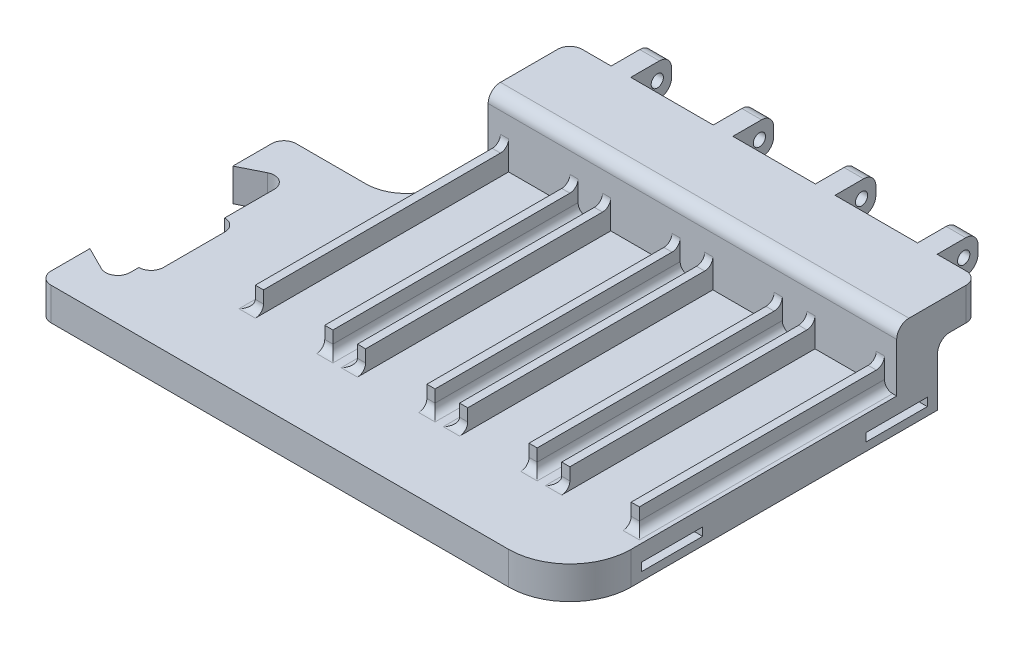
from build123d import *

# Parameters (mm, degrees)
CROQUIS1_R                 = 1.5
SALIENTE_EXTRUIR1_DEPTH    = 50
CORTAR_EXTRUIR1_DEPTH      = 123.737524824
CORTAR_EXTRUIR1_DEPTH_BACK = 123.737524824
CROQUIS2_W                 = 10.1
CROQUIS2_H                 = 10
CROQUIS2_W_2               = 20.2
REDONDEO3_R                = 3
CROQUIS6_W                 = 80
CROQUIS6_H                 = 15
CORTAR_EXTRUIR5_DEPTH      = 151.214846137
CROQUIS29_W                = 2
CROQUIS29_H                = 60
SALIENTE_EXTRUIR16_DEPTH   = 5
REDONDEO17_R               = 2
CROQUIS19_W                = 60
CROQUIS19_H                = 8
SALIENTE_EXTRUIR10_DEPTH   = 30
REDONDEO12_R               = 15
REDONDEO15_R               = 3
REDONDEO23_R               = 10
CORTAR_EXTRUIR6_DEPTH      = 139.047998899
CORTAR_EXTRUIR4_DEPTH      = 138.71165528
CORTAR_EXTRUIR4_DEPTH_BACK = 138.71165528
CROQUIS4_W                 = 15
CROQUIS4_H                 = 2
REDONDEO24_R               = 3
CROQUIS31_W                = 3
CROQUIS31_H                = 21
CORTAR_EXTRUIR7_DEPTH      = 139.047998899
REDONDEO27_R               = 3


with BuildPart() as part:
    # Croquis1 → Saliente-Extruir1 (new, symmetric)
    with BuildSketch(Plane(origin=(0, 0, 0), x_dir=(0, 0, -1), z_dir=(1, 0, 0))):
        Polygon((-1.5, 11.5), (-1.5, 3.5), (-21.5, 3.5), (-21.5, -11.5), (-111.5, -11.5), (-111.5, 11.5), align=None)
        with Locations((-5, 7.5)):
            Circle(CROQUIS1_R, mode=Mode.SUBTRACT)
    extrude(amount=SALIENTE_EXTRUIR1_DEPTH, both=True)

    # Croquis2 → Cortar-Extruir1 (cut, two sides: drawn at the far end of the back side and taken through both)
    with BuildSketch(Plane(origin=(0, 0, 0), x_dir=(1, 0, 0), z_dir=(0, 1, 0)).offset(-CORTAR_EXTRUIR1_DEPTH_BACK)):
        with Locations((-44.95, -6.5)):
            Rectangle(CROQUIS2_W, CROQUIS2_H)
        with Locations((-25, -6.5)):
            Rectangle(CROQUIS2_W_2, CROQUIS2_H)
        with Locations((0, -6.5)):
            Rectangle(CROQUIS2_W_2, CROQUIS2_H)
        with Locations((25, -6.5)):
            Rectangle(CROQUIS2_W_2, CROQUIS2_H)
        with Locations((44.95, -6.5)):
            Rectangle(CROQUIS2_W, CROQUIS2_H)
    extrude(amount=CORTAR_EXTRUIR1_DEPTH + CORTAR_EXTRUIR1_DEPTH_BACK, mode=Mode.SUBTRACT)

    # Redondeo3
    redondeo3_edges = [part.edges().sort_by_distance(p)[0] for p in [
        (0, 3.5, 21.5),
        (37.5, 11.5, 1.5),
        (12.5, 11.5, 1.5),
        (-12.5, 11.5, 1.5),
        (-37.5, 11.5, 1.5),
        (37.5, 3.5, 1.5),
        (12.5, 3.5, 1.5),
        (-12.5, 3.5, 1.5),
        (-37.5, 3.5, 1.5),
        (-50, 7.5, 11.5),
        (50, 7.5, 11.5),
    ]]
    fillet(redondeo3_edges, radius=REDONDEO3_R)

    # Croquis6 → Cortar-Extruir5 (cut, through all)
    with BuildSketch(Plane.ZY.offset(50)):
        with Locations((71.5, 4)):
            Rectangle(CROQUIS6_W, CROQUIS6_H)
    extrude(amount=-CORTAR_EXTRUIR5_DEPTH, mode=Mode.SUBTRACT)

    # Croquis29 → Saliente-Extruir16 (add)
    with BuildSketch(Plane(origin=(0, -3.5, 0), x_dir=(1, 0, 0), z_dir=(0, 1, 0))):
        with Locations((-46, -61.5)):
            Rectangle(CROQUIS29_W, CROQUIS29_H)
        with Locations((-29, -61.5)):
            Rectangle(CROQUIS29_W, CROQUIS29_H)
        with Locations((-21, -61.5)):
            Rectangle(CROQUIS29_W, CROQUIS29_H)
        with Locations((-4, -61.5)):
            Rectangle(CROQUIS29_W, CROQUIS29_H)
        with Locations((4, -61.5)):
            Rectangle(CROQUIS29_W, CROQUIS29_H)
        with Locations((21, -61.5)):
            Rectangle(CROQUIS29_W, CROQUIS29_H)
        with Locations((29, -61.5)):
            Rectangle(CROQUIS29_W, CROQUIS29_H)
        with Locations((46, -61.5)):
            Rectangle(CROQUIS29_W, CROQUIS29_H)
    extrude(amount=SALIENTE_EXTRUIR16_DEPTH)

    # Redondeo17
    redondeo17_edges = [part.edges().sort_by_distance(p)[0] for p in [
        (-46, -3.5, 91.5),
        (-47, -3.5, 61.5),
        (-46, 1.5, 31.5),
        (-29, -3.5, 91.5),
        (-28, -3.5, 61.5),
        (-29, 1.5, 31.5),
        (-21, -3.5, 91.5),
        (-22, -3.5, 61.5),
        (-21, 1.5, 31.5),
        (-4, -3.5, 91.5),
        (-3, -3.5, 61.5),
        (-4, 1.5, 31.5),
        (4, -3.5, 91.5),
        (3, -3.5, 61.5),
        (4, 1.5, 31.5),
        (21, -3.5, 91.5),
        (22, -3.5, 61.5),
        (21, 1.5, 31.5),
        (29, -3.5, 91.5),
        (28, -3.5, 61.5),
        (29, 1.5, 31.5),
        (46, -3.5, 91.5),
        (47, -3.5, 61.5),
        (46, 1.5, 31.5),
    ]]
    fillet(redondeo17_edges, radius=REDONDEO17_R)

    # Croquis19 → Saliente-Extruir10 (add)
    with BuildSketch(Plane.ZY.offset(50)):
        with Locations((81.5, -7.5)):
            Rectangle(CROQUIS19_W, CROQUIS19_H)
    extrude(amount=SALIENTE_EXTRUIR10_DEPTH)

    # Redondeo12
    redondeo12_edges = [part.edges().sort_by_distance(p)[0] for p in [
        (50, -7.5, 111.5),
    ]]
    fillet(redondeo12_edges, radius=REDONDEO12_R)

    # Redondeo15
    redondeo15_edges = [part.edges().sort_by_distance(p)[0] for p in [
        (0, 11.5, 31.5),
    ]]
    fillet(redondeo15_edges, radius=REDONDEO15_R)

    # Redondeo23
    redondeo23_edges = [part.edges().sort_by_distance(p)[0] for p in [
        (-50, -7.5, 51.5),
    ]]
    fillet(redondeo23_edges, radius=REDONDEO23_R)

    # Croquis30 → Cortar-Extruir6 (cut, through all)
    with BuildSketch(Plane(origin=(0, -3.5, 0), x_dir=(1, 0, 0), z_dir=(0, 1, 0))):
        with BuildLine():
            Line((-80, -64), (-74.341640786, -61.170820393))
            ThreePointArc((-74.341640786, -61.170820393), (-71.422806664, -61.302149541), (-70, -63.854101966))
            Line((-70, -63.854101966), (-70, -99.145898034))
            ThreePointArc((-70, -99.145898034), (-71.422806664, -101.697850459), (-74.341640786, -101.829179607))
            Line((-74.341640786, -101.829179607), (-80, -99))
            Line((-80, -99), (-80, -64))
        make_face()
    extrude(amount=-CORTAR_EXTRUIR6_DEPTH, mode=Mode.SUBTRACT)

    # Croquis4 → Cortar-Extruir4 (cut, two sides: drawn at the far end of the back side and taken through both)
    with BuildSketch(Plane(origin=(0, 0, 0), x_dir=(0, 0, -1), z_dir=(1, 0, 0)).offset(-CORTAR_EXTRUIR4_DEPTH_BACK)):
        with Locations((-86.5, -8.5)):
            Rectangle(CROQUIS4_W, CROQUIS4_H)
        with Locations((-31.5, -8.5)):
            Rectangle(CROQUIS4_W, CROQUIS4_H)
    extrude(amount=CORTAR_EXTRUIR4_DEPTH + CORTAR_EXTRUIR4_DEPTH_BACK, mode=Mode.SUBTRACT)

    # Redondeo24
    redondeo24_edges = [part.edges().sort_by_distance(p)[0] for p in [
        (-80, -7.5, 111.5),
        (-80, -7.5, 51.5),
    ]]
    fillet(redondeo24_edges, radius=REDONDEO24_R)

    # Croquis31 → Cortar-Extruir7 (cut, through all)
    with BuildSketch(Plane(origin=(0, -3.5, 0), x_dir=(1, 0, 0), z_dir=(0, 1, 0))):
        with Locations((-68.5, -86.5)):
            Rectangle(CROQUIS31_W, CROQUIS31_H)
    extrude(amount=-CORTAR_EXTRUIR7_DEPTH, mode=Mode.SUBTRACT)

    # Redondeo27
    redondeo27_edges = [part.edges().sort_by_distance(p)[0] for p in [
        (-67, -7.5, 76),
        (-67, -7.5, 97),
    ]]
    fillet(redondeo27_edges, radius=REDONDEO27_R - 0.0001)  # a hair under: the kernel refuses the full size


solid = part.part
